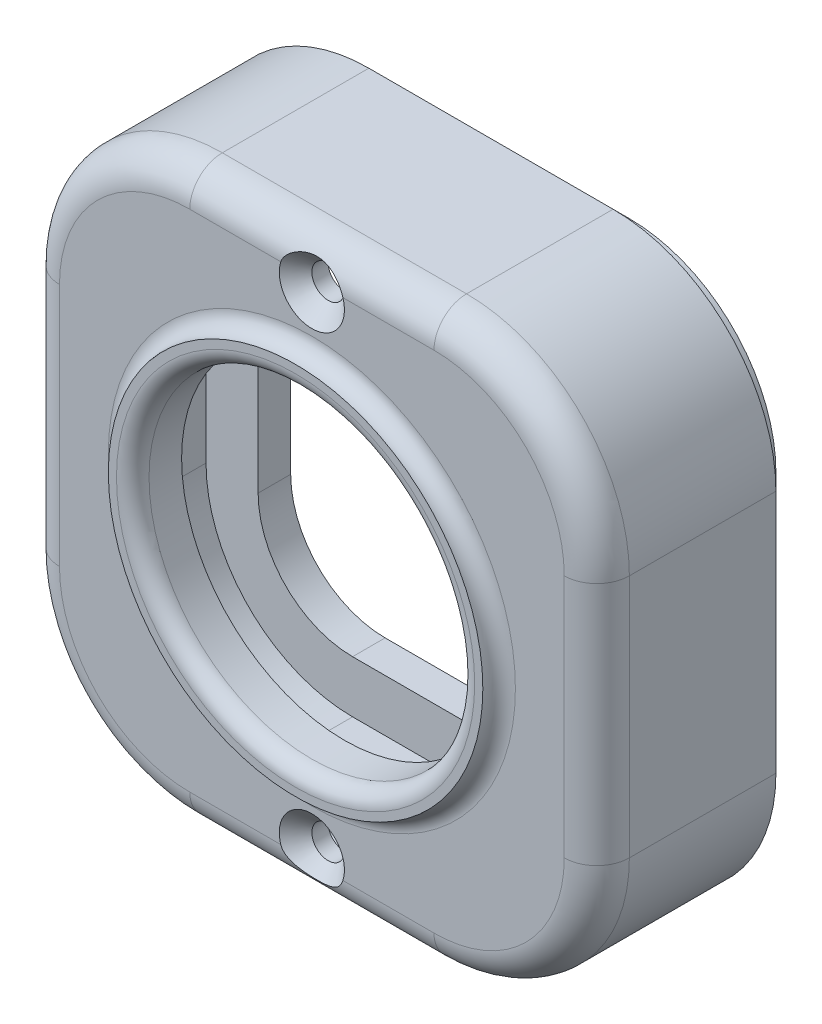
from build123d import *

# Parameters (mm, degrees)
BOSS_EXTRUDE1_DEPTH     = 2.54
SKETCH3_R               = 14.605
BOSS_EXTRUDE2_DEPTH     = 1.27
CUT_EXTRUDE1_DEPTH      = 32.66097519
CUT_EXTRUDE1_DEPTH_BACK = 32.66097519
SKETCH4_R               = 12.7
BOSS_EXTRUDE3_START     = 11.43
BOSS_EXTRUDE3_DEPTH     = 11.43
BOSS_EXTRUDE5_START     = 1.27
BOSS_EXTRUDE5_DEPTH     = 2.54
FILLET2_R               = 1.27
CUT_EXTRUDE2_DEPTH      = 36.503258301
CUT_EXTRUDE2_DEPTH_BACK = 36.503258301
SKETCH7_R               = 1.27
CHAMFER1_SIZE           = 1.27
FILLET3_R               = 2.54


# Some blends are built 0.0001 mm under size
with BuildPart() as part:
    # Sketch2 → Boss-Extrude1 (new body)
    with BuildSketch(Plane.XY):
        with BuildLine():
            Line((-9.525, -22.225), (9.525, -22.225))
            ThreePointArc((9.525, -22.225), (18.505256121, -18.505256121), (22.225, -9.525))
            Line((22.225, -9.525), (22.225, 9.525))
            ThreePointArc((22.225, 9.525), (18.505256121, 18.505256121), (9.525, 22.225))
            Line((9.525, 22.225), (-9.525, 22.225))
            ThreePointArc((-9.525, 22.225), (-18.505256121, 18.505256121), (-22.225, 9.525))
            Line((-22.225, 9.525), (-22.225, -9.525))
            ThreePointArc((-22.225, -9.525), (-18.505256121, -18.505256121), (-9.525, -22.225))
        make_face()
    extrude(amount=BOSS_EXTRUDE1_DEPTH)

    # Sketch3 → Boss-Extrude2 (add)
    with BuildSketch(Plane.XY.offset(2.54)):
        Circle(SKETCH3_R)
    extrude(amount=BOSS_EXTRUDE2_DEPTH)

    # Sketch4 → Cut-Extrude1 (cut, two sides: drawn at the far end of the back side and taken through both)
    with BuildSketch(Plane.XY.offset(3.81).offset(-CUT_EXTRUDE1_DEPTH_BACK)):
        Circle(SKETCH4_R)
    extrude(amount=CUT_EXTRUDE1_DEPTH + CUT_EXTRUDE1_DEPTH_BACK, mode=Mode.SUBTRACT)

    # Sketch5 → Boss-Extrude3 (add)
    with BuildSketch(Plane(origin=(0, 0, 0), x_dir=(-1, 0, 0), z_dir=(0, 0, -1)).offset(BOSS_EXTRUDE3_START)):
        with BuildLine():
            Line((-22.225, 9.525), (-22.225, -9.525))
            ThreePointArc((-22.225, -9.525), (-18.505256121, -18.505256121), (-9.525, -22.225))
            Line((-9.525, -22.225), (9.525, -22.225))
            ThreePointArc((9.525, -22.225), (18.505256121, -18.505256121), (22.225, -9.525))
            Line((22.225, -9.525), (22.225, 9.525))
            ThreePointArc((22.225, 9.525), (18.505256121, 18.505256121), (9.525, 22.225))
            Line((9.525, 22.225), (-9.525, 22.225))
            ThreePointArc((-9.525, 22.225), (-18.505256121, 18.505256121), (-22.225, 9.525))
        make_face()
        with BuildLine():
            Line((-9.525, 20.955), (9.525, 20.955))
            ThreePointArc((9.525, 20.955), (17.607230509, 17.607230509), (20.955, 9.525))
            Line((20.955, 9.525), (20.955, -9.525))
            ThreePointArc((20.955, -9.525), (17.607230509, -17.607230509), (9.525, -20.955))
            Line((9.525, -20.955), (-9.525, -20.955))
            ThreePointArc((-9.525, -20.955), (-17.607230509, -17.607230509), (-20.955, -9.525))
            Line((-20.955, -9.525), (-20.955, 9.525))
            ThreePointArc((-20.955, 9.525), (-17.607230509, 17.607230509), (-9.525, 20.955))
        make_face(mode=Mode.SUBTRACT)
    extrude(amount=-BOSS_EXTRUDE3_DEPTH)

    # Sketch6 → Boss-Extrude5 (add)
    with BuildSketch(Plane(origin=(0, 0, -11.43), x_dir=(-1, 0, 0), z_dir=(0, 0, -1)).offset(BOSS_EXTRUDE5_START)):
        with BuildLine():
            Line((-9.525, 20.955), (9.525, 20.955))
            ThreePointArc((9.525, 20.955), (17.607230509, 17.607230509), (20.955, 9.525))
            Line((20.955, 9.525), (20.955, -9.525))
            ThreePointArc((20.955, -9.525), (17.607230509, -17.607230509), (9.525, -20.955))
            Line((9.525, -20.955), (-9.525, -20.955))
            ThreePointArc((-9.525, -20.955), (-17.607230509, -17.607230509), (-20.955, -9.525))
            Line((-20.955, -9.525), (-20.955, 9.525))
            ThreePointArc((-20.955, 9.525), (-17.607230509, 17.607230509), (-9.525, 20.955))
        make_face()
        with BuildLine():
            Line((-9.525, 16.891), (9.525, 16.891))
            ThreePointArc((9.525, 16.891), (14.73354855, 14.73354855), (16.891, 9.525))
            Line((16.891, 9.525), (16.891, -9.525))
            ThreePointArc((16.891, -9.525), (14.73354855, -14.73354855), (9.525, -16.891))
            Line((9.525, -16.891), (-9.525, -16.891))
            ThreePointArc((-9.525, -16.891), (-14.73354855, -14.73354855), (-16.891, -9.525))
            Line((-16.891, -9.525), (-16.891, 9.525))
            ThreePointArc((-16.891, 9.525), (-14.73354855, 14.73354855), (-9.525, 16.891))
        make_face(mode=Mode.SUBTRACT)
    extrude(amount=-BOSS_EXTRUDE5_DEPTH)

    # Fillet2
    fillet2_edges = [part.edges().sort_by_distance(p)[0] for p in [
        (-14.605, 0, 2.54),
        (-12.7, 0, 3.81),
    ]]
    fillet(fillet2_edges, radius=FILLET2_R - 0.0001)  # a hair under: the kernel refuses the full size

    # Sketch7 → Cut-Extrude2 (cut, two sides: drawn at the far end of the back side and taken through both)
    with BuildSketch(Plane(origin=(0, 0, -12.7), x_dir=(-1, 0, 0), z_dir=(0, 0, -1)).offset(-CUT_EXTRUDE2_DEPTH_BACK)):
        with Locations((0, 18.923)):
            Circle(SKETCH7_R)
        with Locations((0, -18.923)):
            Circle(SKETCH7_R)
    extrude(amount=CUT_EXTRUDE2_DEPTH + CUT_EXTRUDE2_DEPTH_BACK, mode=Mode.SUBTRACT)

    # Chamfer1
    chamfer1_edges = [part.edges().sort_by_distance(p)[0] for p in [
        (1.27, 18.923, 2.54),
        (1.27, -18.923, 2.54),
    ]]
    chamfer(chamfer1_edges, length=CHAMFER1_SIZE)

    # Fillet3
    # the kernel refuses this fillet: 2.54 mm, written as the material it takes off along each edge
    with BuildSketch(Plane(origin=(9.525, -9.525, 2.54), x_dir=(0, -1, 0), z_dir=(-1, 0, 0))) as fillet3_piece_1:
        with BuildLine():
            CenterArc((12.7 - FILLET3_R, -FILLET3_R), FILLET3_R, 0, 90)
            Line((12.7, -FILLET3_R), (12.7, 0))
            Line((12.7, 0), (12.7 - FILLET3_R, 0))
        make_face()
    revolve(axis=Axis((9.525, -9.525, 2.54), (0, 0, 1)), revolution_arc=90, mode=Mode.SUBTRACT)
    with BuildSketch(Plane(origin=(22.225, -9.525, 2.54), x_dir=(-1, 0, 0), z_dir=(0, 1, 0)), Plane(origin=(9.525, 22.225, 2.54), x_dir=(0, -1, 0), z_dir=(-1, 0, 0)), Plane(origin=(-22.225, 9.525, 2.54), x_dir=(1, 0, 0), z_dir=(0, -1, 0)), Plane(origin=(-9.525, -22.225, 2.54), x_dir=(0, 1, 0), z_dir=(1, 0, 0))) as fillet3_piece_2:
        with BuildLine():
            CenterArc((FILLET3_R, -FILLET3_R), FILLET3_R, 90, 90)
            Line((0, -FILLET3_R), (0, 0))
            Line((0, 0), (FILLET3_R, 0))
        make_face()
    extrude(amount=19.05, mode=Mode.SUBTRACT)
    with BuildSketch(Plane(origin=(9.525, 9.525, 2.54), x_dir=(1, 0, 0), z_dir=(0, -1, 0))) as fillet3_piece_3:
        with BuildLine():
            CenterArc((12.7 - FILLET3_R, -FILLET3_R), FILLET3_R, 0, 90)
            Line((12.7, -FILLET3_R), (12.7, 0))
            Line((12.7, 0), (12.7 - FILLET3_R, 0))
        make_face()
    revolve(axis=Axis((9.525, 9.525, 2.54), (0, 0, 1)), revolution_arc=90, mode=Mode.SUBTRACT)
    with BuildSketch(Plane(origin=(-9.525, 9.525, 2.54), x_dir=(0, 1, 0), z_dir=(1, 0, 0))) as fillet3_piece_4:
        with BuildLine():
            CenterArc((12.7 - FILLET3_R, -FILLET3_R), FILLET3_R, 0, 90)
            Line((12.7, -FILLET3_R), (12.7, 0))
            Line((12.7, 0), (12.7 - FILLET3_R, 0))
        make_face()
    revolve(axis=Axis((-9.525, 9.525, 2.54), (0, 0, 1)), revolution_arc=90, mode=Mode.SUBTRACT)
    with BuildSketch(Plane(origin=(-9.525, -9.525, 2.54), x_dir=(-1, 0, 0), z_dir=(0, 1, 0))) as fillet3_piece_5:
        with BuildLine():
            CenterArc((12.7 - FILLET3_R, -FILLET3_R), FILLET3_R, 0, 90)
            Line((12.7, -FILLET3_R), (12.7, 0))
            Line((12.7, 0), (12.7 - FILLET3_R, 0))
        make_face()
    revolve(axis=Axis((-9.525, -9.525, 2.54), (0, 0, 1)), revolution_arc=90, mode=Mode.SUBTRACT)


solid = part.part
